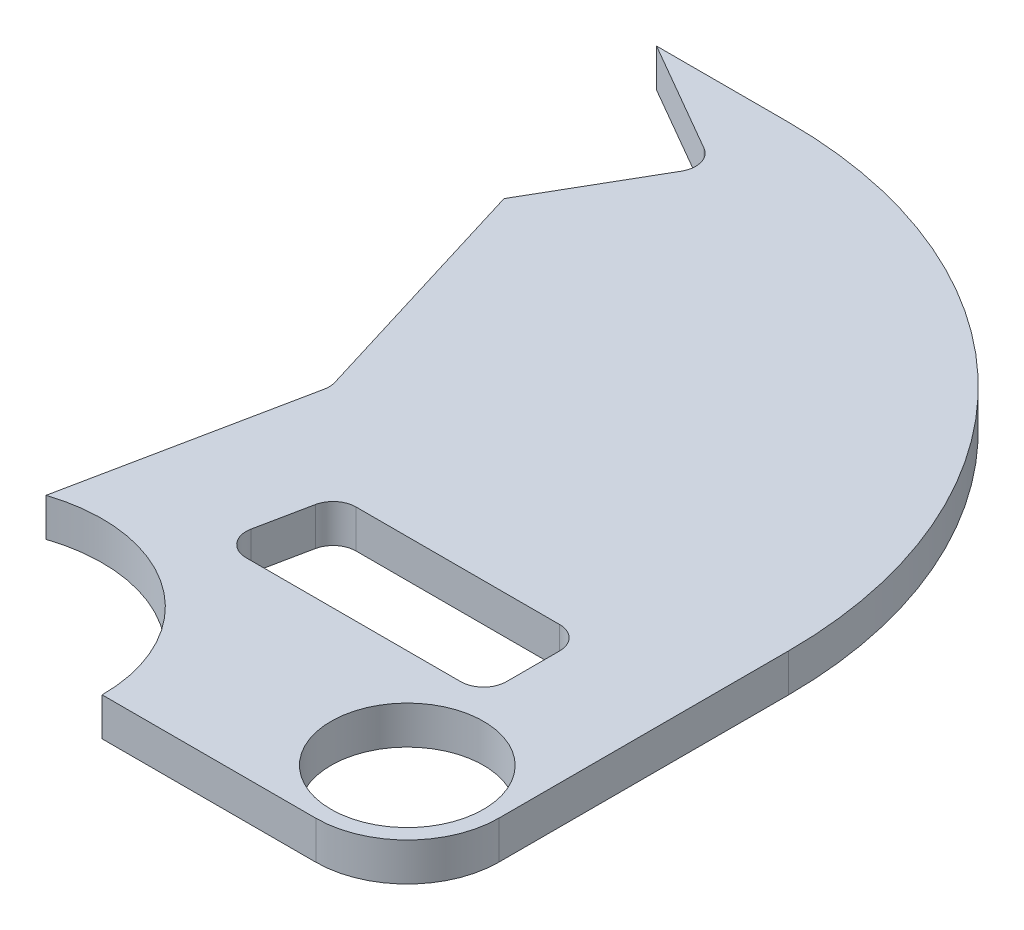
from build123d import *

# Parameters (mm, degrees)
PROFILE_SKETCH_R      = 10
PROFILE_EXTRUDE_DEPTH = 5
TRAPEZOID_FILLET_R    = 3
CLAW_FILLET_R         = 3


with BuildPart() as part:
    # Profile Sketch → Profile Extrude (new body)
    with BuildSketch(Plane(origin=(0, 0, 0), x_dir=(1, 0, 0), z_dir=(0, 1, 0))):
        with BuildLine():
            Line((0, 60), (-17.320508076, 60))
            Line((-17.320508076, 60), (0, 50))
            Line((0, 50), (-10, 32.679491924))
            Line((-10, 32.679491924), (0, 0))
            Line((0, 0), (-6.333857356, -31.029437252))
            ThreePointArc((-6.333857356, -31.029437252), (11.690227818, -33.772289947), (20, -50))
            Line((20, -50), (48, -50))
            ThreePointArc((48, -50), (56.485281374, -46.485281374), (60, -38))
            Line((60, -38), (60, 0))
            ThreePointArc((60, 0), (42.426406871, 42.426406871), (0, 60))
        make_face()
        with Locations((48, -38)):
            Circle(PROFILE_SKETCH_R, mode=Mode.SUBTRACT)
        Polygon((12.853812296, -12.029437252), (45, -12.029437252), (45, -25), (10.206207262, -25), align=None, mode=Mode.SUBTRACT)
    extrude(amount=PROFILE_EXTRUDE_DEPTH)

    # Trapezoid Fillet
    trapezoid_fillet_edges = [part.edges().sort_by_distance(p)[0] for p in [
        (45, 2.5, 12.029437252),
        (45, 2.5, 25),
        (10.206207262, 2.5, 25),
        (12.853812296, 2.5, 12.029437252),
    ]]
    fillet(trapezoid_fillet_edges, radius=TRAPEZOID_FILLET_R)

    # Claw Fillet
    claw_fillet_edges = [part.edges().sort_by_distance(p)[0] for p in [
        (0, 2.5, 0),
        (0, 2.5, -50),
    ]]
    fillet(claw_fillet_edges, radius=CLAW_FILLET_R)


solid = part.part
